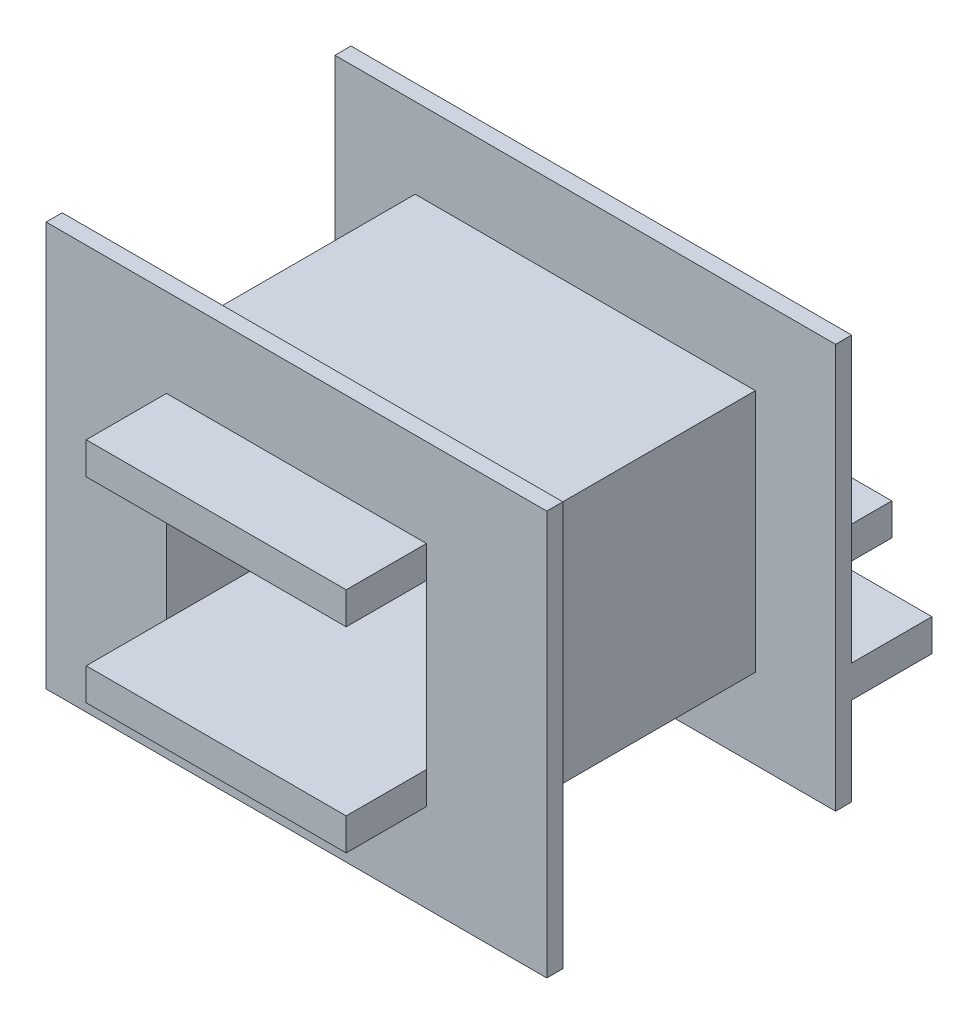
from build123d import *

# Parameters (mm, degrees)
BOSS_EXTRUDE1_DEPTH      = 9.5
BOSS_EXTRUDE1_DEPTH_BACK = 9.5
SKETCH1_W                = 31.2
SKETCH1_H                = 25.2
SKETCH1_W_2              = 16.2
SKETCH1_H_2              = 10.2
SKETCH2_W                = 31.2
SKETCH2_H                = 17
CUT_EXTRUDE1_DEPTH       = 5
SKETCH3_W                = 17
SKETCH3_H                = 15.2
CUT_EXTRUDE2_DEPTH       = 5
SKETCH4_W                = 16.2
SKETCH4_H                = 2
BOSS_EXTRUDE2_DEPTH      = 5
BOSS_EXTRUDE3_DEPTH      = 2
SKETCH6_W                = 16.2
SKETCH6_H                = 5
CUT_EXTRUDE3_DEPTH       = 2


with BuildPart() as part:
    # Sketch1 → Boss-Extrude1 (new, two sides: drawn at the far end of the back side and taken through both)
    with BuildSketch(Plane.XY.offset(-BOSS_EXTRUDE1_DEPTH_BACK)):
        Rectangle(SKETCH1_W, SKETCH1_H)
        Rectangle(SKETCH1_W_2, SKETCH1_H_2, mode=Mode.SUBTRACT)
    extrude(amount=BOSS_EXTRUDE1_DEPTH + BOSS_EXTRUDE1_DEPTH_BACK)

    # Sketch2 → Cut-Extrude1 (cut)
    with BuildSketch(Plane(origin=(0, 12.6, 0), x_dir=(1, 0, 0), z_dir=(0, 1, 0))):
        Rectangle(SKETCH2_W, SKETCH2_H)
    cut_extrude1 = extrude(amount=-CUT_EXTRUDE1_DEPTH, mode=Mode.SUBTRACT)

    # Mirror1: Cut-Extrude1 across plane
    add(cut_extrude1.mirror(Plane.ZX), mode=Mode.SUBTRACT)

    # Sketch3 → Cut-Extrude2 (cut)
    with BuildSketch(Plane(origin=(15.6, 0, 0), x_dir=(0, 0, -1), z_dir=(1, 0, 0))):
        Rectangle(SKETCH3_W, SKETCH3_H)
    cut_extrude2 = extrude(amount=-CUT_EXTRUDE2_DEPTH, mode=Mode.SUBTRACT)

    # Mirror2: Cut-Extrude2 across plane
    add(cut_extrude2.mirror(Plane(origin=(0, 0, 0), x_dir=(0, 0, 1), z_dir=(1, 0, 0))), mode=Mode.SUBTRACT)

    # Sketch4 → Boss-Extrude2 (add)
    with BuildSketch(Plane.XY.offset(9.5)):
        with Locations((0, 6.1)):
            Rectangle(SKETCH4_W, SKETCH4_H)
        with Locations((0, -6.1)):
            Rectangle(SKETCH4_W, SKETCH4_H)
    boss_extrude2 = extrude(amount=BOSS_EXTRUDE2_DEPTH)

    # Mirror3: Boss-Extrude2 across plane
    add(boss_extrude2.mirror(Plane.XY))

    # Sketch5 → Boss-Extrude3 (add)
    with BuildSketch(Plane(origin=(0, -5.1, 0), x_dir=(1, 0, 0), z_dir=(0, 1, 0))):
        Polygon((-8.1, 19.5), (8.1, 19.5), (8.1, 14.5), (15.6, 14.5), (15.6, 9.5), (8.1, 9.5), (-8.1, 9.5), (-15.6, 9.5), (-15.6, 14.5), (-8.1, 14.5), align=None)
    extrude(amount=-BOSS_EXTRUDE3_DEPTH)

    # Sketch6 → Cut-Extrude3 (cut)
    with BuildSketch(Plane(origin=(0, 7.1, 0), x_dir=(1, 0, 0), z_dir=(0, 1, 0))):
        with Locations((0, 12)):
            Rectangle(SKETCH6_W, SKETCH6_H)
    extrude(amount=-CUT_EXTRUDE3_DEPTH, mode=Mode.SUBTRACT)


solid = part.part
